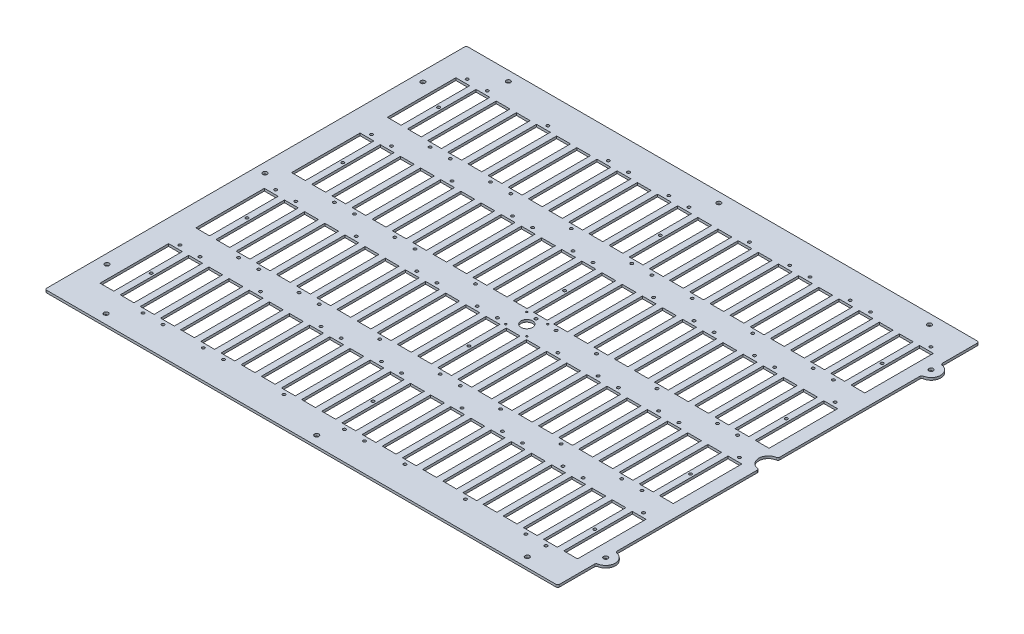
from build123d import *

# Parameters (mm, degrees)
BOSS_EXTRUDE1_DEPTH          = 3.175
SKETCH17_W                   = 18.288
SKETCH17_H                   = 90.932
CUT_EXTRUDE5_DEPTH           = 451.265762746
F_25_0_1495_DIAMETER_HOLE1_D = 3.7973
FILLET1_R                    = 2.54
F_6_CLEARANCE_HOLE1_D        = 3.7973
F_2_CLEARANCE_HOLE1_D        = 2.4384
SKETCH20_R                   = 7.62
CUT_EXTRUDE6_DEPTH           = 451.265762746
F_1_0_228_DIAMETER_HOLE1_D   = 5.7912


with BuildPart() as part:
    # Sketch1 → Boss-Extrude1 (new body)
    with BuildSketch(Plane(origin=(0, 0, 0), x_dir=(1, 0, 0), z_dir=(0, 1, 0))):
        with BuildLine():
            Line((340.2584, 228.6), (340.2584, 279.5524))
            Line((340.2584, 279.5524), (-340.2584, 279.5524))
            Line((-340.2584, 279.5524), (-340.2584, -279.5524))
            Line((-340.2584, -279.5524), (340.2584, -279.5524))
            Line((340.2584, -279.5524), (340.2584, -228.6))
            ThreePointArc((340.2584, -228.6), (352.9584, -215.9), (340.2584, -203.2))
            Line((340.2584, -203.2), (340.2584, -12.7))
            ThreePointArc((340.2584, -12.7), (327.5584, 0), (340.2584, 12.7))
            Line((340.2584, 12.7), (340.2584, 203.2))
            ThreePointArc((340.2584, 203.2), (352.9584, 215.9), (340.2584, 228.6))
        make_face()
    extrude(amount=BOSS_EXTRUDE1_DEPTH)

    # Sketch17 → Cut-Extrude5 (cut, through all)
    with BuildSketch(Plane(origin=(0, 3.175, 0), x_dir=(1, 0, 0), z_dir=(0, 1, 0))):
        with Locations((-274.696582609, 190.6524)):
            Rectangle(SKETCH17_W, SKETCH17_H)
        with Locations((-301.4472, 190.6524)):
            Rectangle(SKETCH17_W, SKETCH17_H)
        with Locations((-247.945965217, 190.6524)):
            Rectangle(SKETCH17_W, SKETCH17_H)
        with Locations((-221.195347826, 190.6524)):
            Rectangle(SKETCH17_W, SKETCH17_H)
        with Locations((-194.444730435, 190.6524)):
            Rectangle(SKETCH17_W, SKETCH17_H)
        with Locations((-167.694113043, 190.6524)):
            Rectangle(SKETCH17_W, SKETCH17_H)
        with Locations((-140.943495652, 190.6524)):
            Rectangle(SKETCH17_W, SKETCH17_H)
        with Locations((-114.192878261, 190.6524)):
            Rectangle(SKETCH17_W, SKETCH17_H)
        with Locations((-87.44226087, 190.6524)):
            Rectangle(SKETCH17_W, SKETCH17_H)
        with Locations((-60.691643478, 190.6524)):
            Rectangle(SKETCH17_W, SKETCH17_H)
        with Locations((-33.941026087, 190.6524)):
            Rectangle(SKETCH17_W, SKETCH17_H)
        with Locations((-7.190408696, 190.6524)):
            Rectangle(SKETCH17_W, SKETCH17_H)
        with Locations((19.560208696, 190.6524)):
            Rectangle(SKETCH17_W, SKETCH17_H)
        with Locations((46.310826087, 190.6524)):
            Rectangle(SKETCH17_W, SKETCH17_H)
        with Locations((73.061443478, 190.6524)):
            Rectangle(SKETCH17_W, SKETCH17_H)
        with Locations((99.81206087, 190.6524)):
            Rectangle(SKETCH17_W, SKETCH17_H)
        with Locations((126.562678261, 190.6524)):
            Rectangle(SKETCH17_W, SKETCH17_H)
        with Locations((153.313295652, 190.6524)):
            Rectangle(SKETCH17_W, SKETCH17_H)
        with Locations((180.063913043, 190.6524)):
            Rectangle(SKETCH17_W, SKETCH17_H)
        with Locations((206.814530435, 190.6524)):
            Rectangle(SKETCH17_W, SKETCH17_H)
        with Locations((233.565147826, 190.6524)):
            Rectangle(SKETCH17_W, SKETCH17_H)
        with Locations((260.315765217, 190.6524)):
            Rectangle(SKETCH17_W, SKETCH17_H)
        with Locations((287.066382609, 190.6524)):
            Rectangle(SKETCH17_W, SKETCH17_H)
        with Locations((313.817, 190.6524)):
            Rectangle(SKETCH17_W, SKETCH17_H)
        with Locations((-274.696582609, 63.5762)):
            Rectangle(SKETCH17_W, SKETCH17_H)
        with Locations((-247.945965217, 63.5762)):
            Rectangle(SKETCH17_W, SKETCH17_H)
        with Locations((-221.195347826, 63.5762)):
            Rectangle(SKETCH17_W, SKETCH17_H)
        with Locations((-194.444730435, 63.5762)):
            Rectangle(SKETCH17_W, SKETCH17_H)
        with Locations((-167.694113043, 63.5762)):
            Rectangle(SKETCH17_W, SKETCH17_H)
        with Locations((-140.943495652, 63.5762)):
            Rectangle(SKETCH17_W, SKETCH17_H)
        with Locations((-114.192878261, 63.5762)):
            Rectangle(SKETCH17_W, SKETCH17_H)
        with Locations((-87.44226087, 63.5762)):
            Rectangle(SKETCH17_W, SKETCH17_H)
        with Locations((-60.691643478, 63.5762)):
            Rectangle(SKETCH17_W, SKETCH17_H)
        with Locations((-33.941026087, 63.5762)):
            Rectangle(SKETCH17_W, SKETCH17_H)
        with Locations((-7.190408696, 63.5762)):
            Rectangle(SKETCH17_W, SKETCH17_H)
        with Locations((19.560208696, 63.5762)):
            Rectangle(SKETCH17_W, SKETCH17_H)
        with Locations((46.310826087, 63.5762)):
            Rectangle(SKETCH17_W, SKETCH17_H)
        with Locations((73.061443478, 63.5762)):
            Rectangle(SKETCH17_W, SKETCH17_H)
        with Locations((99.81206087, 63.5762)):
            Rectangle(SKETCH17_W, SKETCH17_H)
        with Locations((126.562678261, 63.5762)):
            Rectangle(SKETCH17_W, SKETCH17_H)
        with Locations((153.313295652, 63.5762)):
            Rectangle(SKETCH17_W, SKETCH17_H)
        with Locations((180.063913043, 63.5762)):
            Rectangle(SKETCH17_W, SKETCH17_H)
        with Locations((206.814530435, 63.5762)):
            Rectangle(SKETCH17_W, SKETCH17_H)
        with Locations((233.565147826, 63.5762)):
            Rectangle(SKETCH17_W, SKETCH17_H)
        with Locations((260.315765217, 63.5762)):
            Rectangle(SKETCH17_W, SKETCH17_H)
        with Locations((287.066382609, 63.5762)):
            Rectangle(SKETCH17_W, SKETCH17_H)
        with Locations((313.817, 63.5762)):
            Rectangle(SKETCH17_W, SKETCH17_H)
        with Locations((-274.696582609, -63.5)):
            Rectangle(SKETCH17_W, SKETCH17_H)
        with Locations((-247.945965217, -63.5)):
            Rectangle(SKETCH17_W, SKETCH17_H)
        with Locations((-221.195347826, -63.5)):
            Rectangle(SKETCH17_W, SKETCH17_H)
        with Locations((-194.444730435, -63.5)):
            Rectangle(SKETCH17_W, SKETCH17_H)
        with Locations((-167.694113043, -63.5)):
            Rectangle(SKETCH17_W, SKETCH17_H)
        with Locations((-140.943495652, -63.5)):
            Rectangle(SKETCH17_W, SKETCH17_H)
        with Locations((-114.192878261, -63.5)):
            Rectangle(SKETCH17_W, SKETCH17_H)
        with Locations((-87.44226087, -63.5)):
            Rectangle(SKETCH17_W, SKETCH17_H)
        with Locations((-60.691643478, -63.5)):
            Rectangle(SKETCH17_W, SKETCH17_H)
        with Locations((-33.941026087, -63.5)):
            Rectangle(SKETCH17_W, SKETCH17_H)
        with Locations((-7.190408696, -63.5)):
            Rectangle(SKETCH17_W, SKETCH17_H)
        with Locations((19.560208696, -63.5)):
            Rectangle(SKETCH17_W, SKETCH17_H)
        with Locations((46.310826087, -63.5)):
            Rectangle(SKETCH17_W, SKETCH17_H)
        with Locations((73.061443478, -63.5)):
            Rectangle(SKETCH17_W, SKETCH17_H)
        with Locations((99.81206087, -63.5)):
            Rectangle(SKETCH17_W, SKETCH17_H)
        with Locations((126.562678261, -63.5)):
            Rectangle(SKETCH17_W, SKETCH17_H)
        with Locations((153.313295652, -63.5)):
            Rectangle(SKETCH17_W, SKETCH17_H)
        with Locations((180.063913043, -63.5)):
            Rectangle(SKETCH17_W, SKETCH17_H)
        with Locations((206.814530435, -63.5)):
            Rectangle(SKETCH17_W, SKETCH17_H)
        with Locations((233.565147826, -63.5)):
            Rectangle(SKETCH17_W, SKETCH17_H)
        with Locations((260.315765217, -63.5)):
            Rectangle(SKETCH17_W, SKETCH17_H)
        with Locations((287.066382609, -63.5)):
            Rectangle(SKETCH17_W, SKETCH17_H)
        with Locations((313.817, -63.5)):
            Rectangle(SKETCH17_W, SKETCH17_H)
        with Locations((-274.696582609, -190.5762)):
            Rectangle(SKETCH17_W, SKETCH17_H)
        with Locations((-247.945965217, -190.5762)):
            Rectangle(SKETCH17_W, SKETCH17_H)
        with Locations((-221.195347826, -190.5762)):
            Rectangle(SKETCH17_W, SKETCH17_H)
        with Locations((-194.444730435, -190.5762)):
            Rectangle(SKETCH17_W, SKETCH17_H)
        with Locations((-167.694113043, -190.5762)):
            Rectangle(SKETCH17_W, SKETCH17_H)
        with Locations((-140.943495652, -190.5762)):
            Rectangle(SKETCH17_W, SKETCH17_H)
        with Locations((-114.192878261, -190.5762)):
            Rectangle(SKETCH17_W, SKETCH17_H)
        with Locations((-87.44226087, -190.5762)):
            Rectangle(SKETCH17_W, SKETCH17_H)
        with Locations((-60.691643478, -190.5762)):
            Rectangle(SKETCH17_W, SKETCH17_H)
        with Locations((-33.941026087, -190.5762)):
            Rectangle(SKETCH17_W, SKETCH17_H)
        with Locations((-7.190408696, -190.5762)):
            Rectangle(SKETCH17_W, SKETCH17_H)
        with Locations((19.560208696, -190.5762)):
            Rectangle(SKETCH17_W, SKETCH17_H)
        with Locations((46.310826087, -190.5762)):
            Rectangle(SKETCH17_W, SKETCH17_H)
        with Locations((73.061443478, -190.5762)):
            Rectangle(SKETCH17_W, SKETCH17_H)
        with Locations((99.81206087, -190.5762)):
            Rectangle(SKETCH17_W, SKETCH17_H)
        with Locations((126.562678261, -190.5762)):
            Rectangle(SKETCH17_W, SKETCH17_H)
        with Locations((153.313295652, -190.5762)):
            Rectangle(SKETCH17_W, SKETCH17_H)
        with Locations((180.063913043, -190.5762)):
            Rectangle(SKETCH17_W, SKETCH17_H)
        with Locations((206.814530435, -190.5762)):
            Rectangle(SKETCH17_W, SKETCH17_H)
        with Locations((233.565147826, -190.5762)):
            Rectangle(SKETCH17_W, SKETCH17_H)
        with Locations((260.315765217, -190.5762)):
            Rectangle(SKETCH17_W, SKETCH17_H)
        with Locations((287.066382609, -190.5762)):
            Rectangle(SKETCH17_W, SKETCH17_H)
        with Locations((313.817, -190.5762)):
            Rectangle(SKETCH17_W, SKETCH17_H)
        with Locations((-301.4472, 63.5762)):
            Rectangle(SKETCH17_W, SKETCH17_H)
        with Locations((-301.4472, -63.5)):
            Rectangle(SKETCH17_W, SKETCH17_H)
        with Locations((-301.4472, -190.5762)):
            Rectangle(SKETCH17_W, SKETCH17_H)
    extrude(amount=-CUT_EXTRUDE5_DEPTH, mode=Mode.SUBTRACT)

    # #25 (0.1495) Diameter Hole1 (through all)
    with Locations(Plane(origin=(0, 3.175, 0), x_dir=(1, 0, 0), z_dir=(0, 1, 0))):
        with Locations((313.816998222, -139.2682), (-301.4472, 241.9604), (-274.696582686, 241.9604), (-247.945965372, 139.3444), (-221.195348058, 139.3444), (-194.444730744, 241.9604), (-167.69411343, 139.3444), (-140.943496116, 139.3444), (-114.192878802, 241.9604), (-87.442261488, 241.9604), (-60.691644174, 139.3444), (-33.94102686, 241.9604), (-7.190409546, 241.9604), (19.560207768, 139.3444), (46.310825082, 139.3444), (73.061442396, 241.9604), (99.81205971, 139.3444), (126.562677024, 241.9604), (153.313294338, 241.9604), (180.063911652, 139.3444), (206.814528966, 241.9604), (233.56514628, 241.9604), (260.315763594, 139.3444), (287.066380908, 139.3444), (313.816998222, 241.9604), (-301.4472, 114.8842), (-274.696582686, 114.8842), (-247.945965372, 12.2682), (-221.195348058, 12.2682), (-194.444730744, 114.8842), (-167.69411343, 12.2682), (-140.943496116, 12.2682), (-114.192878802, 114.8842), (-87.442261488, 114.8842), (-60.691644174, 12.2682), (-33.94102686, 114.8842), (-7.190409546, 114.8842), (19.560207768, 12.2682), (46.310825082, 12.2682), (73.061442396, 114.8842), (99.81205971, 12.2682), (126.562677024, 114.8842), (153.313294338, 114.8842), (180.063911652, 12.2682), (206.814528966, 114.8842), (233.56514628, 114.8842), (260.315763594, 12.2682), (287.066380908, 12.2682), (313.816998222, 114.8842), (-301.4472, -12.192), (-274.696582686, -12.192), (-247.945965372, -114.808), (-221.195348058, -114.808), (-194.444730744, -12.192), (-167.69411343, -114.808), (-140.943496116, -114.808), (-114.192878802, -12.192), (-87.442261488, -12.192), (-60.691644174, -114.808), (-33.94102686, -12.192), (-7.190409546, -12.192), (19.560207768, -114.808), (46.310825082, -114.808), (73.061442396, -12.192), (99.81205971, -114.808), (126.562677024, -12.192), (153.313294338, -12.192), (180.063911652, -114.808), (206.814528966, -12.192), (233.56514628, -12.192), (260.315763594, -114.808), (287.066380908, -114.808), (313.816998222, -12.192), (-301.4472, -139.2682), (-274.696582686, -139.2682), (-247.945965372, -241.8842), (-221.195348058, -241.8842), (-194.444730744, -139.2682), (-167.69411343, -241.8842), (-140.943496116, -241.8842), (-114.192878802, -139.2682), (-87.442261488, -139.2682), (-60.691644174, -241.8842), (-33.94102686, -139.2682), (-7.190409546, -139.2682), (19.560207768, -241.8842), (46.310825082, -241.8842), (73.061442396, -139.2682), (99.81205971, -241.8842), (126.562677024, -139.2682), (153.313294338, -139.2682), (180.063911652, -241.8842), (206.814528966, -139.2682), (233.56514628, -139.2682), (260.315763594, -241.8842), (287.066380908, -241.8842)):
            Hole(F_25_0_1495_DIAMETER_HOLE1_D / 2)

    # Fillet1
    fillet1_edges = [part.edges().sort_by_distance(p)[0] for p in [
        (-340.2584, 1.5875, -279.5524),
        (-340.2584, 1.5875, 279.5524),
        (340.2584, 1.5875, 279.5524),
        (340.2584, 1.5875, 228.6),
        (340.2584, 1.5875, 203.2),
        (340.2584, 1.5875, 12.7),
        (340.2584, 1.5875, -12.7),
        (340.2584, 1.5875, -203.2),
        (340.2584, 1.5875, -279.5524),
        (340.2584, 1.5875, -228.6),
    ]]
    fillet(fillet1_edges, radius=FILLET1_R)

    # #6 Clearance Hole1 (through all)
    with Locations(Plane(origin=(0, 3.175, 0), x_dir=(1, 0, 0), z_dir=(0, 1, 0))):
        with Locations((300.441691304, -190.5762), (-288.071891304, 190.6524), (6.1849, 190.6524), (300.441691304, 190.6524), (-288.071891304, 63.5762), (6.1849, 63.5762), (300.441691304, 63.5762), (-288.071891304, -63.5), (6.1849, -63.5), (300.441691304, -63.5), (-288.071891304, -190.5762), (6.1849, -190.5762)):
            Hole(F_6_CLEARANCE_HOLE1_D / 2)

    # #2 Clearance Hole1 (through all)
    with Locations(Plane(origin=(0, 3.175, 0), x_dir=(1, 0, 0), z_dir=(0, 1, 0))):
        with Locations((33.5661, 14.0081), (5.6261, 14.0081), (5.6261, -13.9319), (33.5661, -13.9319)):
            Hole(F_2_CLEARANCE_HOLE1_D / 2)

    # Sketch20 → Cut-Extrude6 (cut, through all)
    with BuildSketch(Plane(origin=(0, 3.175, 0), x_dir=(1, 0, 0), z_dir=(0, 1, 0))):
        with Locations((19.5961, 0.0381)):
            Circle(SKETCH20_R)
    extrude(amount=-CUT_EXTRUDE6_DEPTH, mode=Mode.SUBTRACT)

    # #1 (0.228) Diameter Hole1 (through all)
    with Locations(Plane(origin=(0, 3.175, 0), x_dir=(1, 0, 0), z_dir=(0, 1, 0))):
        with Locations((287.274, 266.7), (340.2584, -215.9), (340.2584, 0), (340.2584, 215.9), (287.274, -267.0048), (7.874, -267.0048), (-271.526, -267.0048), (-327.5584, -209.7024), (-327.5584, -0.1524), (-327.5584, 209.3976), (-271.526, 266.7), (7.874, 266.7)):
            Hole(F_1_0_228_DIAMETER_HOLE1_D / 2)


solid = part.part
